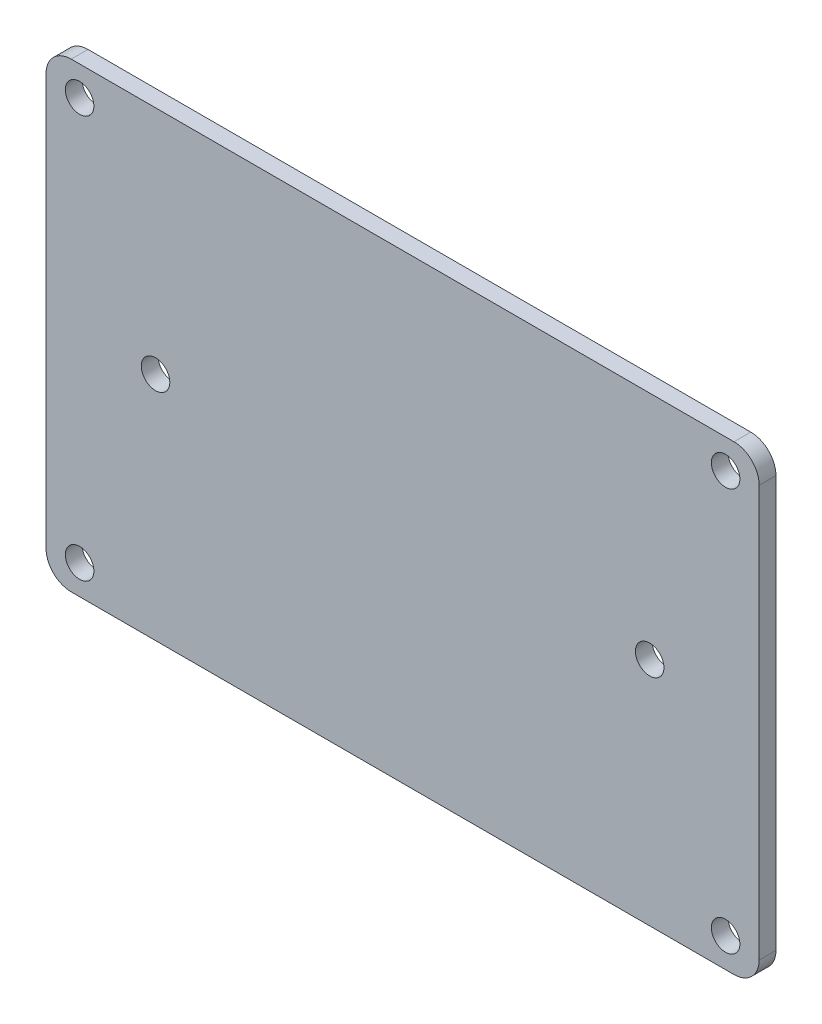
from build123d import *

# Parameters (mm, degrees)
SKETCH1_R           = 1.7
BOSS_EXTRUDE1_DEPTH = 2
CUT_EXTRUDE7_REACH  = 52.661
SKETCH3_R           = 1.7
SKETCH4_R           = 1.7
CUT_EXTRUDE8_DEPTH  = 51.660635606
SKETCH7_R           = 1.7
CUT_EXTRUDE9_DEPTH  = 51.660635606
CUT_EXTRUDE10_REACH = 52.661
SKETCH8_R           = 1.7


with BuildPart() as part:
    # Sketch1 → Boss-Extrude1 (new body)
    with BuildSketch(Plane.XY):
        with BuildLine():
            Line((-39.5, 27.5), (39.5, 27.5))
            ThreePointArc((39.5, 27.5), (41.621320344, 26.621320344), (42.5, 24.5))
            Line((42.5, 24.5), (42.5, -24.5))
            ThreePointArc((42.5, -24.5), (41.621320344, -26.621320344), (39.5, -27.5))
            Line((39.5, -27.5), (-39.5, -27.5))
            ThreePointArc((-39.5, -27.5), (-41.621320344, -26.621320344), (-42.5, -24.5))
            Line((-42.5, -24.5), (-42.5, 24.5))
            ThreePointArc((-42.5, 24.5), (-41.621320344, 26.621320344), (-39.5, 27.5))
        make_face()
        with Locations((-38.5, -24)):
            Circle(SKETCH1_R, mode=Mode.SUBTRACT)
    extrude(amount=BOSS_EXTRUDE1_DEPTH)

    # Sketch3 → Cut-Extrude7 (cut, up to next)
    with BuildSketch(Plane.XY, mode=Mode.PRIVATE) as cut_extrude7_sk1:
        with Locations((38.5, -24)):
            Circle(SKETCH3_R)
    cut_extrude7_tool1 = extrude(cut_extrude7_sk1.sketch, amount=CUT_EXTRUDE7_REACH, mode=Mode.PRIVATE) & part.part
    add(cut_extrude7_tool1.solids().sort_by_distance((38.5, -24, 0))[0], mode=Mode.SUBTRACT)

    # Sketch4 → Cut-Extrude8 (cut, through all)
    with BuildSketch(Plane.XY.offset(2)):
        with Locations((-38.5, 24)):
            Circle(SKETCH4_R)
    extrude(amount=-CUT_EXTRUDE8_DEPTH, mode=Mode.SUBTRACT)

    # Sketch7 → Cut-Extrude9 (cut, through all)
    with BuildSketch(Plane.XY.offset(2)):
        with Locations((38.5, 24)):
            Circle(SKETCH7_R)
    extrude(amount=-CUT_EXTRUDE9_DEPTH, mode=Mode.SUBTRACT)

    # Sketch8 → Cut-Extrude10 (cut, up to next)
    with BuildSketch(Plane(origin=(0, 0, 0), x_dir=(-1, 0, 0), z_dir=(0, 0, -1)), mode=Mode.PRIVATE) as cut_extrude10_sk1:
        with Locations((-29.45, 0)):
            Circle(SKETCH8_R)
    cut_extrude10_tool1 = extrude(cut_extrude10_sk1.sketch, amount=-CUT_EXTRUDE10_REACH, mode=Mode.PRIVATE) & part.part
    # Sketch8 → Cut-Extrude10 (cut, up to next)
    with BuildSketch(Plane(origin=(0, 0, 0), x_dir=(-1, 0, 0), z_dir=(0, 0, -1)), mode=Mode.PRIVATE) as cut_extrude10_sk2:
        with Locations((29.45, 0)):
            Circle(SKETCH8_R)
    cut_extrude10_tool2 = extrude(cut_extrude10_sk2.sketch, amount=-CUT_EXTRUDE10_REACH, mode=Mode.PRIVATE) & part.part
    add(cut_extrude10_tool1.solids().sort_by_distance((29.45, 0, 0))[0], mode=Mode.SUBTRACT)
    add(cut_extrude10_tool2.solids().sort_by_distance((-29.45, 0, 0))[0], mode=Mode.SUBTRACT)


solid = part.part
